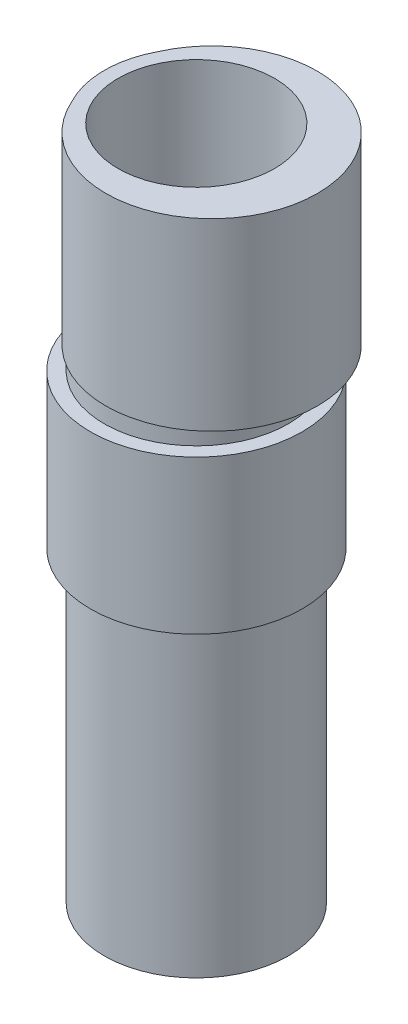
from build123d import *

# Parameters (mm, degrees)
SKETCH1_R                = 3.45
BOSS_EXTRUDE1_DEPTH      = 6
BOSS_EXTRUDE2_DEPTH      = 1
BOSS_EXTRUDE2_DEPTH_BACK = 4
SKETCH2_R                = 3.45
SKETCH3_R                = 3
BOSS_EXTRUDE4_DEPTH      = 22
SKETCH4_R                = 2.55
CUT_EXTRUDE1_DEPTH       = 23.616476295


with BuildPart() as part:
    # Sketch1 → Boss-Extrude1 (new body)
    with BuildSketch(Plane(origin=(0, 0, 0), x_dir=(1, 0, 0), z_dir=(0, 1, 0))):
        Circle(SKETCH1_R)
    extrude(amount=BOSS_EXTRUDE1_DEPTH)



with BuildPart() as body_2:
    # Sketch2 → Boss-Extrude2 (new, two sides: drawn at the far end of the back side and taken through both)
    with BuildSketch(Plane.XZ.offset(4.98).offset(-BOSS_EXTRUDE2_DEPTH_BACK)):
        with Locations((-0.5, 0)):
            Circle(SKETCH2_R)
    extrude(amount=BOSS_EXTRUDE2_DEPTH + BOSS_EXTRUDE2_DEPTH_BACK)


with BuildPart() as part_1:
    add(part.part)

    add(body_2.part)  # Boss-Extrude4 merges body 2
    # Sketch3 → Boss-Extrude4 (add)
    with BuildSketch(Plane(origin=(0, 6, 0), x_dir=(1, 0, 0), z_dir=(0, 1, 0))):
        with Locations((-0.5, 0)):
            Circle(SKETCH3_R)
    extrude(amount=-BOSS_EXTRUDE4_DEPTH)

    # Sketch4 → Cut-Extrude1 (cut, through all)
    with BuildSketch(Plane.XZ.offset(16)):
        with Locations((-0.5, 0)):
            Circle(SKETCH4_R)
    extrude(amount=-CUT_EXTRUDE1_DEPTH, mode=Mode.SUBTRACT)


solid = part_1.part
